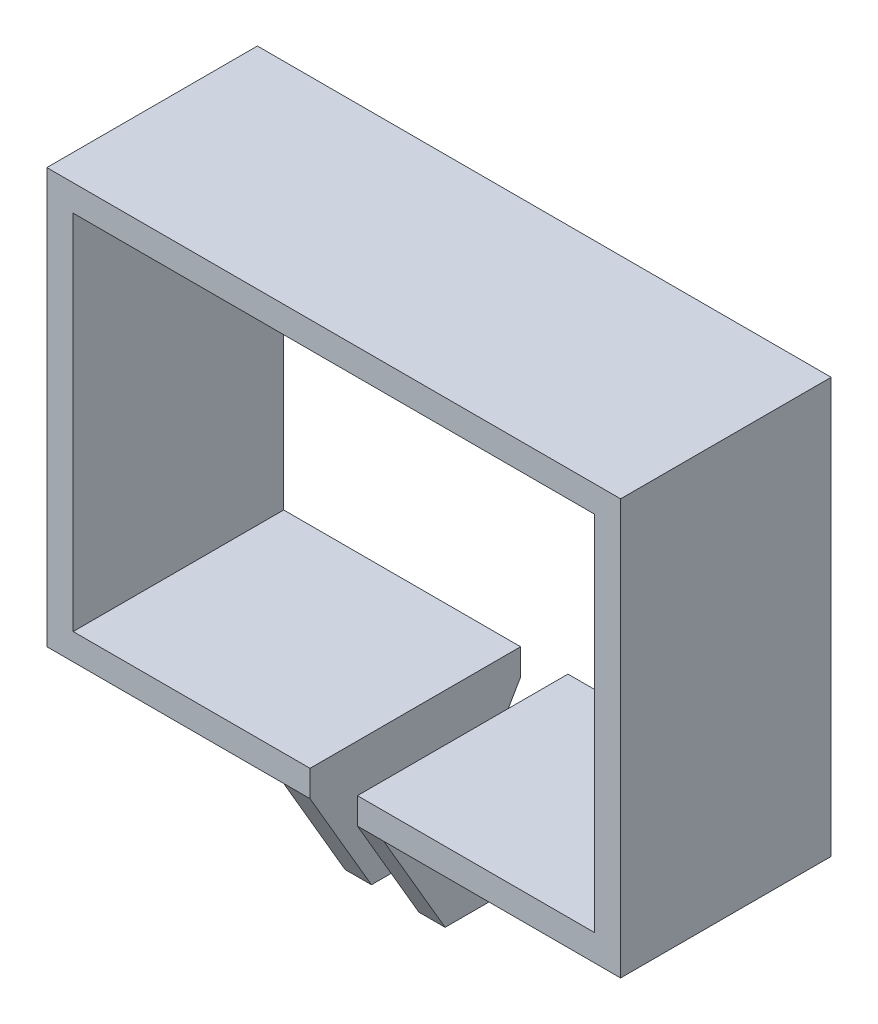
from build123d import *

# Parameters (mm, degrees)
EXTRU_MINCE1_DEPTH      = 24
ESQUISSE2_R             = 2.25
ENL_V_MAT_EXTRU_1_DEPTH = 20


with BuildPart() as part:
    # Esquisse1 → Extru.-Mince1 (new body)
    with BuildSketch(Plane.XY):
        Polygon((-2.7, -35.65), (-2.7, -20.65), (-29.7, -20.65), (-29.7, 20.65), (29.7, 20.65), (29.7, -20.65), (2.7, -20.65), (2.7, -35.65), (5.7, -35.65), (5.7, -23.65), (32.7, -23.65), (32.7, 23.65), (-32.7, 23.65), (-32.7, -23.65), (-5.7, -23.65), (-5.7, -35.65), align=None)
    extrude(amount=EXTRU_MINCE1_DEPTH)

    # Esquisse2 → Enlèv. mat.-Extru.1 (cut)
    with BuildSketch(Plane.ZY.offset(5.7)):
        with Locations((12, -30.65)):
            Circle(ESQUISSE2_R)
        Polygon((0, -23.65), (7, -35.65), (0, -35.65), align=None)
        Polygon((17, -35.65), (24, -35.65), (24, -23.65), align=None)
    extrude(amount=-ENL_V_MAT_EXTRU_1_DEPTH, mode=Mode.SUBTRACT)


solid = part.part
